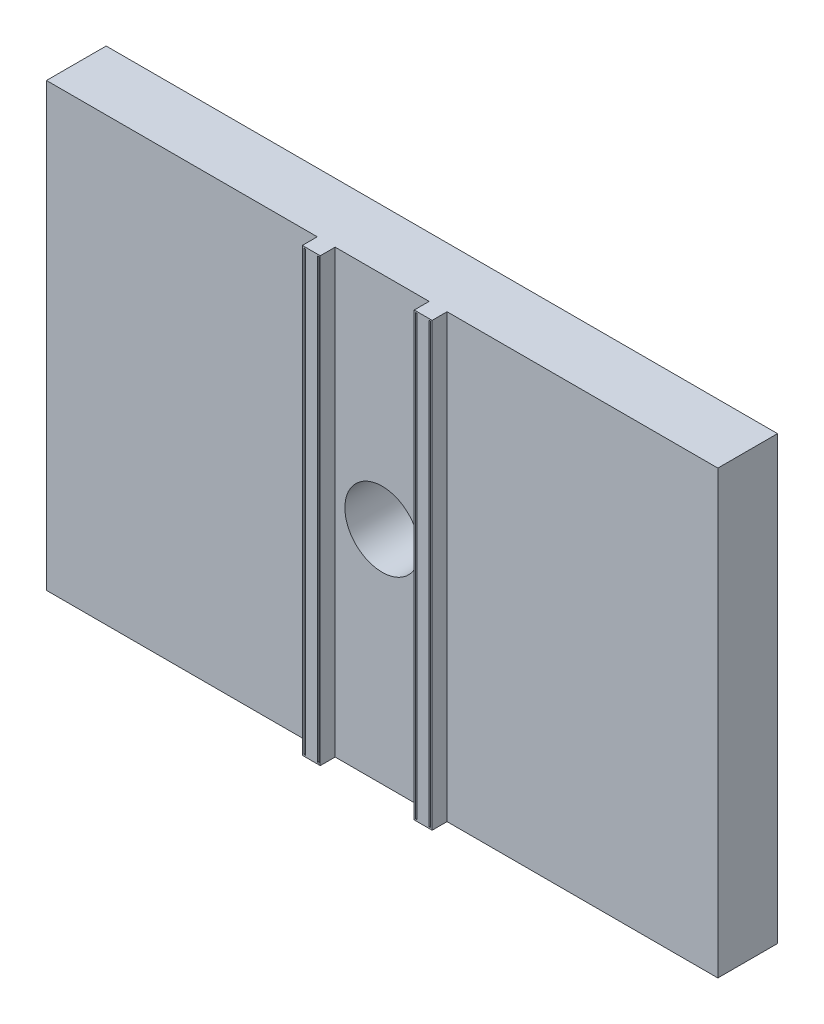
from build123d import *
from build123d.topology import SkipClean

# Parameters (mm, degrees)
SKETCH1_W                 = 57.15
SKETCH1_H                 = 37.592
BOSS_EXTRUDE1_DEPTH       = 10.16
SKETCH2_W                 = 0.254
SKETCH2_H                 = 37.592
SKETCH2_W_2               = 2.032
BOSS_EXTRUDE2_DEPTH       = 2.54
SKETCH3_R                 = 6.35
CUT_EXTRUDE1_DEPTH        = 21.082
SKETCH4_R                 = 2.032
CUT_EXTRUDE2_DEPTH        = 5.08
SKETCH5_W                 = 2.54
SKETCH5_H                 = 0.254
BOSS_EXTRUDE3_DEPTH       = 3.048
MIRROR2_COPY_1_SKETCH_W   = 57.15
MIRROR2_COPY_1_SKETCH_H   = 37.592
MIRROR2_COPY_1_DEPTH      = 10.16
MIRROR2_COPY_2_SKETCH_W   = 0.254
MIRROR2_COPY_2_SKETCH_H   = 37.592
MIRROR2_COPY_2_SKETCH_W_2 = 2.032
MIRROR2_COPY_2_DEPTH      = 2.54
MIRROR2_COPY_3_SKETCH_R   = 6.35
MIRROR2_COPY_3_DEPTH      = 21.082
MIRROR2_COPY_4_SKETCH_R   = 2.032
MIRROR2_COPY_4_DEPTH      = 5.08
MIRROR2_COPY_5_SKETCH_W   = 2.54
MIRROR2_COPY_5_SKETCH_H   = 0.254
MIRROR2_COPY_5_DEPTH      = 3.048


with BuildPart() as part:
    # Sketch1 → Boss-Extrude1 (new body)
    with BuildSketch(Plane.XY):
        with Locations((0.47625, 18.796)):
            Rectangle(SKETCH1_W, SKETCH1_H)
    boss_extrude1 = extrude(amount=BOSS_EXTRUDE1_DEPTH)

    # Sketch2 → Boss-Extrude2 (add)
    with BuildSketch(Plane.XY.offset(10.16)):
        with Locations((-19.97075, 18.796)):
            Rectangle(SKETCH2_W, SKETCH2_H)
        with Locations((-18.57375, 18.796)):
            Rectangle(SKETCH2_W_2, SKETCH2_H)
        with Locations((-17.17675, 18.796)):
            Rectangle(SKETCH2_W, SKETCH2_H)
    boss_extrude2 = extrude(amount=BOSS_EXTRUDE2_DEPTH)

    # Sketch3 → Cut-Extrude1 (cut)
    with BuildSketch(Plane.XY.offset(10.16)):
        with Locations((-28.09875, 0)):
            Circle(SKETCH3_R)
    cut_extrude1 = extrude(amount=-CUT_EXTRUDE1_DEPTH, mode=Mode.SUBTRACT)

    # Sketch4 → Cut-Extrude2 (cut)
    with BuildSketch(Plane(origin=(0, 0, 0), x_dir=(-1, 0, 0), z_dir=(0, 0, -1))):
        with Locations((12.004431959, 16.094318041)):
            Circle(SKETCH4_R)
    cut_extrude2 = extrude(amount=-CUT_EXTRUDE2_DEPTH, mode=Mode.SUBTRACT)

    # Sketch5 → Boss-Extrude3 (add)
    with BuildSketch(Plane.ZY.offset(20.09775)):
        with Locations((11.43, 37.465)):
            Rectangle(SKETCH5_W, SKETCH5_H)
    boss_extrude3 = extrude(amount=-BOSS_EXTRUDE3_DEPTH)

    # Mirror1: Boss-Extrude1, Boss-Extrude2, Cut-Extrude1, Cut-Extrude2, Boss-Extrude3 across plane
    with SkipClean():  # the faces are left unmerged after this step: merging them gives an invalid solid
        add(boss_extrude1.mirror(Plane(origin=(-28.09875, 37.592, 10.16), x_dir=(0, 0, 1), z_dir=(1, 0, 0))))
        add(boss_extrude2.mirror(Plane(origin=(-28.09875, 37.592, 10.16), x_dir=(0, 0, 1), z_dir=(1, 0, 0))))
        add(cut_extrude1.mirror(Plane(origin=(-28.09875, 37.592, 10.16), x_dir=(0, 0, 1), z_dir=(1, 0, 0))), mode=Mode.SUBTRACT)
        add(cut_extrude2.mirror(Plane(origin=(-28.09875, 37.592, 10.16), x_dir=(0, 0, 1), z_dir=(1, 0, 0))), mode=Mode.SUBTRACT)
        add(boss_extrude3.mirror(Plane(origin=(-28.09875, 37.592, 10.16), x_dir=(0, 0, 1), z_dir=(1, 0, 0))))
    add(part.part.scale(1), mode=Mode.REPLACE)  # the faces are merged on a copy

    # Mirror2: Boss-Extrude1, Boss-Extrude2, Cut-Extrude1, Cut-Extrude2, Boss-Extrude3 across plane
    with SkipClean():  # the faces are left unmerged after this step: merging them gives an invalid solid
        add(boss_extrude1.mirror(Plane.ZX))
        add(boss_extrude2.mirror(Plane.ZX))
        add(cut_extrude1.mirror(Plane.ZX), mode=Mode.SUBTRACT)
        add(cut_extrude2.mirror(Plane.ZX), mode=Mode.SUBTRACT)
        add(boss_extrude3.mirror(Plane.ZX))
    add(part.part.scale(1), mode=Mode.REPLACE)  # the faces are merged on a copy

    # Mirror2 copy 1 sketch → Mirror2 copy 1 (add)
    with BuildSketch(Plane(origin=(-56.1975, 0, 0), x_dir=(-1, 0, 0), z_dir=(0, 0, 1))):
        with Locations((0.47625, 18.796)):
            Rectangle(MIRROR2_COPY_1_SKETCH_W, MIRROR2_COPY_1_SKETCH_H)
    extrude(amount=MIRROR2_COPY_1_DEPTH)

    # Mirror2 copy 2 sketch → Mirror2 copy 2 (add)
    with BuildSketch(Plane(origin=(-56.1975, 0, 10.16), x_dir=(-1, 0, 0), z_dir=(0, 0, 1))):
        with Locations((-19.97075, 18.796)):
            Rectangle(MIRROR2_COPY_2_SKETCH_W, MIRROR2_COPY_2_SKETCH_H)
        with Locations((-18.57375, 18.796)):
            Rectangle(MIRROR2_COPY_2_SKETCH_W_2, MIRROR2_COPY_2_SKETCH_H)
        with Locations((-17.17675, 18.796)):
            Rectangle(MIRROR2_COPY_2_SKETCH_W, MIRROR2_COPY_2_SKETCH_H)
    extrude(amount=MIRROR2_COPY_2_DEPTH)

    # Mirror2 copy 3 sketch → Mirror2 copy 3 (cut)
    with SkipClean():  # the faces are left unmerged after this step: merging them gives an invalid solid
        with BuildSketch(Plane(origin=(-56.1975, 0, 10.16), x_dir=(-1, 0, 0), z_dir=(0, 0, 1))):
            with Locations((-28.09875, 0)):
                Circle(MIRROR2_COPY_3_SKETCH_R)
        extrude(amount=-MIRROR2_COPY_3_DEPTH, mode=Mode.SUBTRACT)

    # Mirror2 copy 4 sketch → Mirror2 copy 4 (cut)
    with SkipClean():  # the faces are left unmerged after this step: merging them gives an invalid solid
        with BuildSketch(Plane(origin=(-56.1975, 0, 0), x_dir=(1, 0, 0), z_dir=(0, 0, -1))):
            with Locations((12.004431959, 16.094318041)):
                Circle(MIRROR2_COPY_4_SKETCH_R)
        extrude(amount=-MIRROR2_COPY_4_DEPTH, mode=Mode.SUBTRACT)

    # Mirror2 copy 5 sketch → Mirror2 copy 5 (add)
    with SkipClean():  # the faces are left unmerged after this step: merging them gives an invalid solid
        with BuildSketch(Plane(origin=(-36.09975, 0, 0), x_dir=(0, 0, 1), z_dir=(1, 0, 0))):
            with Locations((11.43, 37.465)):
                Rectangle(MIRROR2_COPY_5_SKETCH_W, MIRROR2_COPY_5_SKETCH_H)
        extrude(amount=-MIRROR2_COPY_5_DEPTH)


solid = part.part
